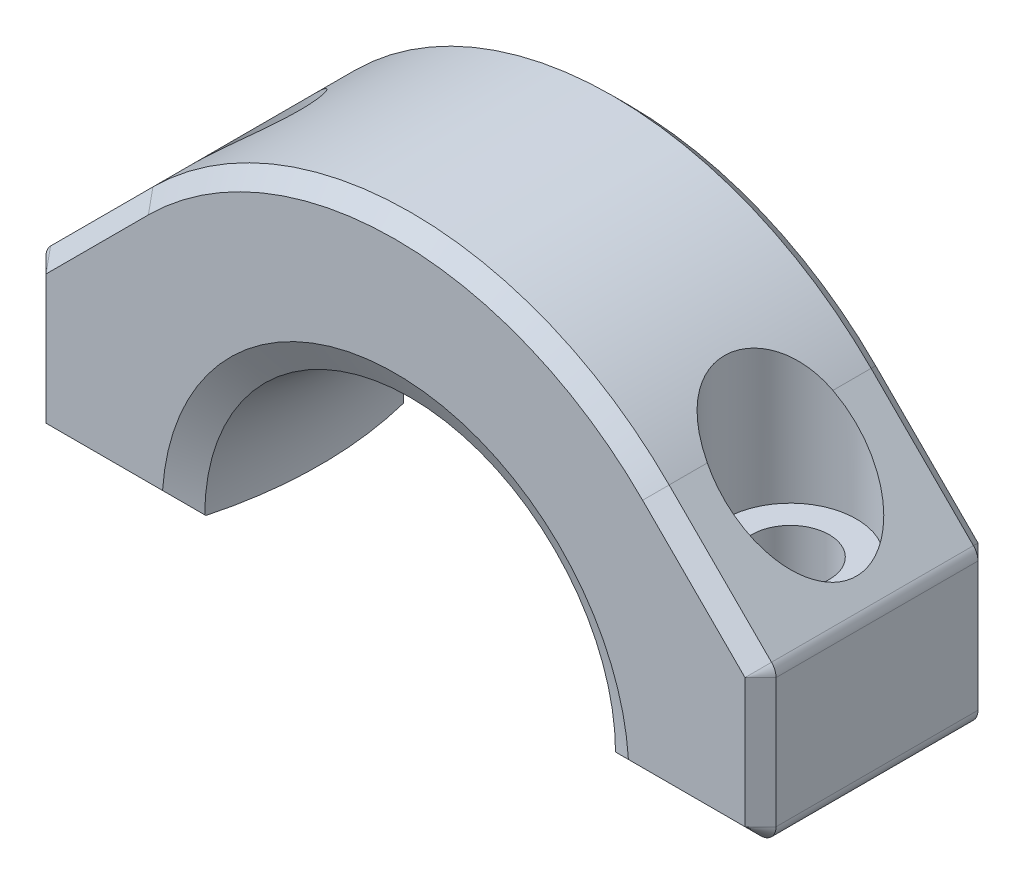
from build123d import *

# Parameters (mm, degrees)
BOSS_EXTRUDE1_DEPTH = 15
REVOLVE1_ANGLE      = 180
SKETCH3_R           = 2.5
CUT_EXTRUDE1_DEPTH  = 37.462309307
CUT_EXTRUDE2_START  = -10
SKETCH4_R           = 4.25
CUT_EXTRUDE2_DEPTH  = 27.462309413
FILLET1_R           = 1
CHAMFER1_SIZE       = 1.529194148
CHAMFER1_SIZE_2     = 1


with BuildPart() as part:
    # Sketch1 → Boss-Extrude1 (new body)
    with BuildSketch(Plane.XY):
        with BuildLine():
            Line((-13.5, 0), (-23.5, 0))
            Line((-23.5, 0), (-23.5, 9.734018716))
            Line((-23.5, 9.734018716), (-16.617009358, 16.617009358))
            ThreePointArc((-16.617009358, 16.617009358), (0, 23.5), (16.617009358, 16.617009358))
            Line((16.617009358, 16.617009358), (23.5, 9.734018716))
            Line((23.5, 9.734018716), (23.5, 0))
            Line((23.5, 0), (13.5, 0))
            ThreePointArc((13.5, 0), (0, 13.5), (-13.5, 0))
        make_face()
    extrude(amount=BOSS_EXTRUDE1_DEPTH)

    # Sketch2 → Revolve1 (revolve)
    with BuildSketch(Plane.XZ):
        with BuildLine():
            Line((-13.5, 15), (-13.5, 0))
            ThreePointArc((-13.5, 0), (-12.348480035, 7.5), (-13.5, 15))
        make_face()
    revolve(axis=Axis((0, 0, 7.5), (0, 0, -1)), revolution_arc=REVOLVE1_ANGLE)

    # Sketch3 → Cut-Extrude1 (cut, through all)
    with BuildSketch(Plane.XZ):
        with Locations((-17.924240018, 7.5)):
            Circle(SKETCH3_R)
        with Locations(Location((17.924240018, 7.5, 0), (0, 0, 121.526459575))):
            Circle(SKETCH3_R)
    extrude(amount=-CUT_EXTRUDE1_DEPTH, mode=Mode.SUBTRACT)

    # Sketch4 → Cut-Extrude2 (cut, through all)
    with BuildSketch(Plane.XZ.offset(CUT_EXTRUDE2_START)):
        with Locations((-17.924240018, 7.5)):
            Circle(SKETCH4_R)
        with Locations(Location((17.924240018, 7.5, 0), (0, 0, 252.086328454))):
            Circle(SKETCH4_R)
    extrude(amount=-CUT_EXTRUDE2_DEPTH, mode=Mode.SUBTRACT)

    # Fillet1
    fillet1_edges = [part.edges().sort_by_distance(p)[0] for p in [
        (23.5, 9.734018716, 7.5),
        (23.5, 0, 7.5),
        (-23.5, 0, 7.5),
        (-23.5, 9.734018716, 7.5),
    ]]
    fillet(fillet1_edges, radius=FILLET1_R)

    # Chamfer1
    # the kernel refuses this chamfer: 1.529194148, 1 mm, written as the material it takes off along each edge
    with BuildSketch(Plane(origin=(0, 0, 15), x_dir=(0.9571659368895994, -0.2895399268810014, 0), z_dir=(-0.2895399268810014, -0.9571659368895994, 0))) as chamfer1_piece_1:
        with BuildLine():
            Line((13.224132078, -0.941354132), (13.5 + CHAMFER1_SIZE, 0))
            Line((13.5 + CHAMFER1_SIZE, 0), (13.5, 0))
            ThreePointArc((13.5, 0), (13.351499892, -0.489654504), (13.224132078, -0.941354132))
        make_face()
    revolve(axis=Axis((0, 0, 15), (0, 0, 1)), revolution_arc=213.660828251, mode=Mode.SUBTRACT)
    with BuildSketch(Plane(origin=(0, 0, 0), x_dir=(0.9613944909393555, -0.27517382286739694, 0), z_dir=(-0.27517382286739694, -0.9613944909393555, 0))) as chamfer1_piece_2:
        with BuildLine():
            Line((13.5 + CHAMFER1_SIZE_2, 0), (13.105478256, 1.394521744))
            ThreePointArc((13.105478256, 1.394521744), (13.285379501, 0.720089037), (13.5, 0))
            Line((13.5, 0), (13.5 + CHAMFER1_SIZE_2, 0))
        make_face()
    revolve(axis=Axis((0, 0, 0), (0, 0, 1)), revolution_arc=211.944746271, mode=Mode.SUBTRACT)
    # the kernel refuses this chamfer: 1.529194148, 1 mm, written as the material it takes off along each edge
    with BuildSketch(Plane(origin=(-23.207106781, 10.026911935, 0), x_dir=(0.7071067811865477, -0.7071067811865475, 0), z_dir=(0.7071067811865475, 0.7071067811865477, 0)), Plane(origin=(16.617009358, 16.617009358, 0), x_dir=(-0.7071067811865477, -0.7071067811865475, 0), z_dir=(0.7071067811865475, -0.7071067811865477, 0))) as chamfer1_2_piece_1:
        Polygon((CHAMFER1_SIZE_2, 0), (0, -CHAMFER1_SIZE_2), (0, 0), align=None)
    extrude(amount=9.319805153, mode=Mode.SUBTRACT)
    with BuildSketch(Plane(origin=(0, 0, 0), x_dir=(-0.7071067811865478, 0.7071067811865472, 0), z_dir=(-0.7071067811865472, -0.7071067811865478, 0))) as chamfer1_2_piece_2:
        Polygon((23.5 - CHAMFER1_SIZE_2, 0), (23.5, -CHAMFER1_SIZE_2), (23.5, 0), align=None)
    revolve(axis=Axis((0, 0, 0), (0, 0, -1)), revolution_arc=90, mode=Mode.SUBTRACT)
    with BuildSketch(Plane(origin=(-23.207106781, 10.026911935, 15), x_dir=(0.7071067811865477, -0.7071067811865475, 0), z_dir=(0.7071067811865475, 0.7071067811865477, 0)), Plane(origin=(16.617009358, 16.617009358, 15), x_dir=(-0.7071067811865477, -0.7071067811865475, 0), z_dir=(0.7071067811865475, -0.7071067811865477, 0))) as chamfer1_2_piece_3:
        Polygon((CHAMFER1_SIZE_2, 0), (0, CHAMFER1_SIZE_2), (0, 0), align=None)
    extrude(amount=9.319805153, mode=Mode.SUBTRACT)
    with BuildSketch(Plane(origin=(22.5, 0, 15), x_dir=(0, 1, 0), z_dir=(-1, 0, 0))) as chamfer1_2_piece_4:
        Polygon((CHAMFER1_SIZE_2, 0), (0, CHAMFER1_SIZE_2), (0, 0), align=None)
    extrude(amount=10.04248884, mode=Mode.SUBTRACT)
    with BuildSketch(Plane(origin=(23.5, 9.319805153, 0), x_dir=(-1, 0, 0), z_dir=(0, -1, 0)), Plane(origin=(-23.5, 1, 0), x_dir=(1, 0, 0), z_dir=(0, 1, 0))) as chamfer1_2_piece_5:
        Polygon((CHAMFER1_SIZE_2, 0), (0, -CHAMFER1_SIZE_2), (0, 0), align=None)
    extrude(amount=8.319805153, mode=Mode.SUBTRACT)
    with BuildSketch(Plane(origin=(23.5, 9.319805153, 15), x_dir=(-1, 0, 0), z_dir=(0, -1, 0)), Plane(origin=(-23.5, 1, 15), x_dir=(1, 0, 0), z_dir=(0, 1, 0))) as chamfer1_2_piece_6:
        Polygon((CHAMFER1_SIZE_2, 0), (0, CHAMFER1_SIZE_2), (0, 0), align=None)
    extrude(amount=8.319805153, mode=Mode.SUBTRACT)
    with BuildSketch(Plane(origin=(-11.928317012, 0, 0), x_dir=(0, 0, 1), z_dir=(-1, 0, 0))) as chamfer1_2_piece_7:
        Polygon((CHAMFER1_SIZE_2, 0), (0, CHAMFER1_SIZE_2), (0, 0), align=None)
    extrude(amount=10.571682988, mode=Mode.SUBTRACT)
    with BuildSketch(Plane(origin=(-22.5, 1, 0), x_dir=(0, -1, 0), z_dir=(1, 0, 0))) as chamfer1_2_piece_8:
        Polygon((1 - CHAMFER1_SIZE_2, 0), (1, -CHAMFER1_SIZE_2), (1, 0), align=None)
    revolve(axis=Axis((-22.5, 1, 0), (0, 0, -1)), revolution_arc=90, mode=Mode.SUBTRACT)
    with BuildSketch(Plane(origin=(-22.5, 9.319805153, 0), x_dir=(-1, 0, 0), z_dir=(0, -1, 0))) as chamfer1_2_piece_9:
        Polygon((1 - CHAMFER1_SIZE_2, 0), (1, -CHAMFER1_SIZE_2), (1, 0), align=None)
    revolve(axis=Axis((-22.5, 9.319805153, 0), (0, 0, -1)), revolution_arc=45, mode=Mode.SUBTRACT)
    with BuildSketch(Plane(origin=(22.5, 9.319805153, 0), x_dir=(0.7071067811865458, 0.7071067811865493, 0), z_dir=(-0.7071067811865493, 0.7071067811865458, 0))) as chamfer1_2_piece_10:
        Polygon((1 - CHAMFER1_SIZE_2, 0), (1, -CHAMFER1_SIZE_2), (1, 0), align=None)
    revolve(axis=Axis((22.5, 9.319805153, 0), (0, 0, -1)), revolution_arc=45, mode=Mode.SUBTRACT)
    with BuildSketch(Plane(origin=(22.5, 1, 0), x_dir=(1, 0, 0), z_dir=(0, 1, 0))) as chamfer1_2_piece_11:
        Polygon((1 - CHAMFER1_SIZE_2, 0), (1, -CHAMFER1_SIZE_2), (1, 0), align=None)
    revolve(axis=Axis((22.5, 1, 0), (0, 0, -1)), revolution_arc=90, mode=Mode.SUBTRACT)
    with BuildSketch(Plane(origin=(-12.45751116, 0, 15), x_dir=(0, 0, -1), z_dir=(-1, 0, 0))) as chamfer1_2_piece_12:
        Polygon((CHAMFER1_SIZE_2, 0), (0, -CHAMFER1_SIZE_2), (0, 0), align=None)
    extrude(amount=10.04248884, mode=Mode.SUBTRACT)
    with BuildSketch(Plane(origin=(-22.5, 1, 15), x_dir=(0, -1, 0), z_dir=(1, 0, 0))) as chamfer1_2_piece_13:
        Polygon((1, CHAMFER1_SIZE_2), (1 - CHAMFER1_SIZE_2, 0), (1, 0), align=None)
    revolve(axis=Axis((-22.5, 1, 15), (0, 0, -1)), revolution_arc=90, mode=Mode.SUBTRACT)
    with BuildSketch(Plane(origin=(-22.5, 9.319805153, 15), x_dir=(-1, 0, 0), z_dir=(0, -1, 0))) as chamfer1_2_piece_14:
        Polygon((1 - CHAMFER1_SIZE_2, 0), (1, CHAMFER1_SIZE_2), (1, 0), align=None)
    revolve(axis=Axis((-22.5, 9.319805153, 15), (0, 0, -1)), revolution_arc=45, mode=Mode.SUBTRACT)
    with BuildSketch(Plane(origin=(22.5, 9.319805153, 15), x_dir=(0.7071067811865458, 0.7071067811865493, 0), z_dir=(-0.7071067811865493, 0.7071067811865458, 0))) as chamfer1_2_piece_15:
        Polygon((1 - CHAMFER1_SIZE_2, 0), (1, CHAMFER1_SIZE_2), (1, 0), align=None)
    revolve(axis=Axis((22.5, 9.319805153, 15), (0, 0, -1)), revolution_arc=45, mode=Mode.SUBTRACT)
    with BuildSketch(Plane(origin=(22.5, 1, 15), x_dir=(1, 0, 0), z_dir=(0, 1, 0))) as chamfer1_2_piece_16:
        Polygon((1 - CHAMFER1_SIZE_2, 0), (1, CHAMFER1_SIZE_2), (1, 0), align=None)
    revolve(axis=Axis((22.5, 1, 15), (0, 0, -1)), revolution_arc=90, mode=Mode.SUBTRACT)
    with BuildSketch(Plane(origin=(0, 0, 15), x_dir=(-0.7071067811865478, 0.7071067811865472, 0), z_dir=(-0.7071067811865472, -0.7071067811865478, 0))) as chamfer1_2_piece_17:
        Polygon((23.5 - CHAMFER1_SIZE_2, 0), (23.5, CHAMFER1_SIZE_2), (23.5, 0), align=None)
    revolve(axis=Axis((0, 0, 15), (0, 0, -1)), revolution_arc=90, mode=Mode.SUBTRACT)
    with BuildSketch(Plane(origin=(22.5, 0, 0), x_dir=(0, 1, 0), z_dir=(-1, 0, 0))) as chamfer1_2_piece_18:
        Polygon((CHAMFER1_SIZE_2, 0), (0, -CHAMFER1_SIZE_2), (0, 0), align=None)
    extrude(amount=10.571682988, mode=Mode.SUBTRACT)


solid = part.part
